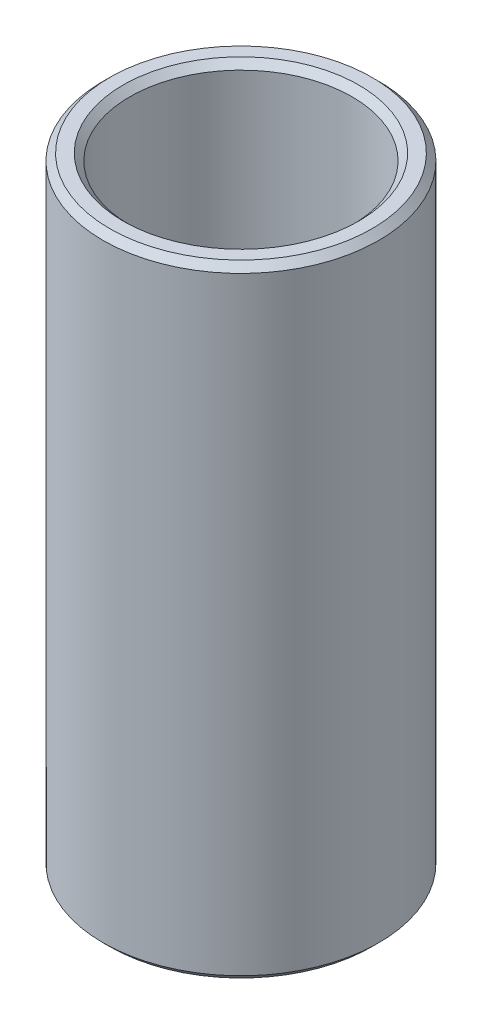
from build123d import *

# Parameters (mm, degrees)
SKETCH1_R           = 45
BOSS_EXTRUDE1_DEPTH = 202.935803829
SKETCH2_R           = 36.268795198
CUT_EXTRUDE1_DEPTH  = 213.680371627
CHAMFER1_SIZE       = 2.207293339


with BuildPart() as part:
    # Sketch1 → Boss-Extrude1 (new body)
    with BuildSketch(Plane(origin=(0, 0, 0), x_dir=(1, 0, 0), z_dir=(0, 1, 0))):
        Circle(SKETCH1_R)
    extrude(amount=BOSS_EXTRUDE1_DEPTH)

    # Sketch2 → Cut-Extrude1 (cut, through all)
    with BuildSketch(Plane(origin=(0, 0, 0), x_dir=(1, 0, 0), z_dir=(0, 1, 0))):
        Circle(SKETCH2_R)
    extrude(amount=CUT_EXTRUDE1_DEPTH, mode=Mode.SUBTRACT)

    # Chamfer1
    chamfer1_edges = [part.edges().sort_by_distance(p)[0] for p in [
        (-36.268795198, 202.935803829, 0),
        (-36.268795198, 0, 0),
        (-45, 0, 0),
        (-45, 202.935803829, 0),
    ]]
    chamfer(chamfer1_edges, length=CHAMFER1_SIZE)


solid = part.part
